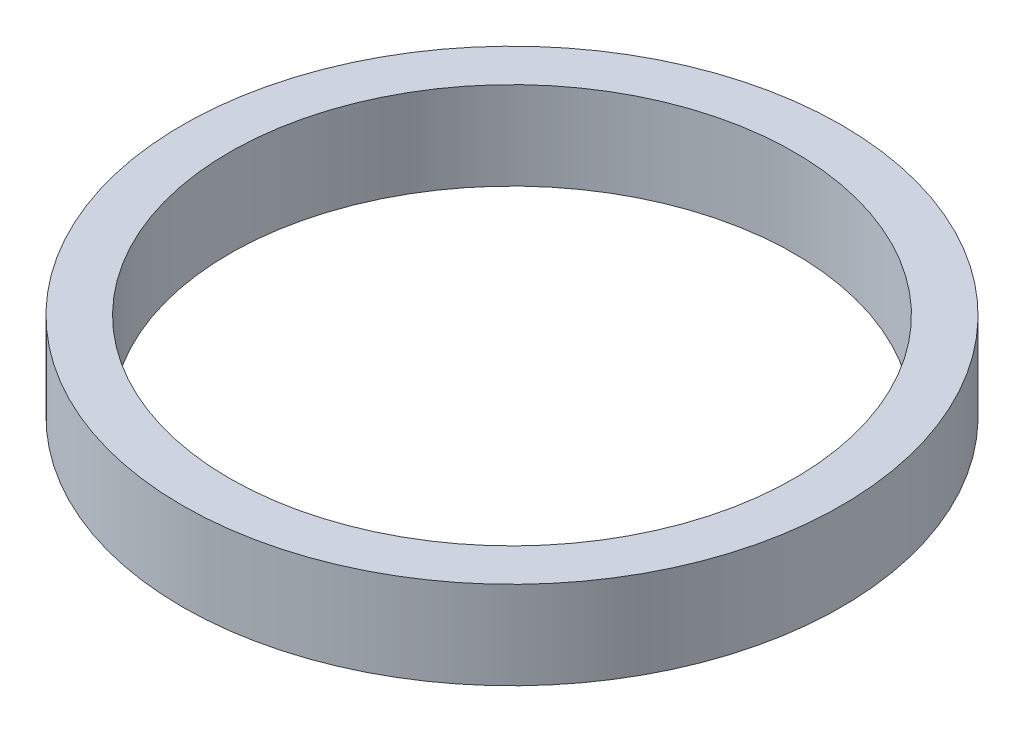
from build123d import *

# Parameters (mm, degrees)
SKETCH1_R           = 52.5
BOSS_EXTRUDE1_DEPTH = 14
SKETCH2_R           = 45
CUT_EXTRUDE1_DEPTH  = 76.554616007


with BuildPart() as part:
    # Sketch1 → Boss-Extrude1 (new body)
    with BuildSketch(Plane(origin=(0, 0, 0), x_dir=(1, 0, 0), z_dir=(0, 1, 0))):
        Circle(SKETCH1_R)
    extrude(amount=BOSS_EXTRUDE1_DEPTH)

    # Sketch2 → Cut-Extrude1 (cut, through all)
    with BuildSketch(Plane(origin=(0, 0, 0), x_dir=(1, 0, 0), z_dir=(0, 1, 0))):
        Circle(SKETCH2_R)
    extrude(amount=CUT_EXTRUDE1_DEPTH, mode=Mode.SUBTRACT)


solid = part.part
